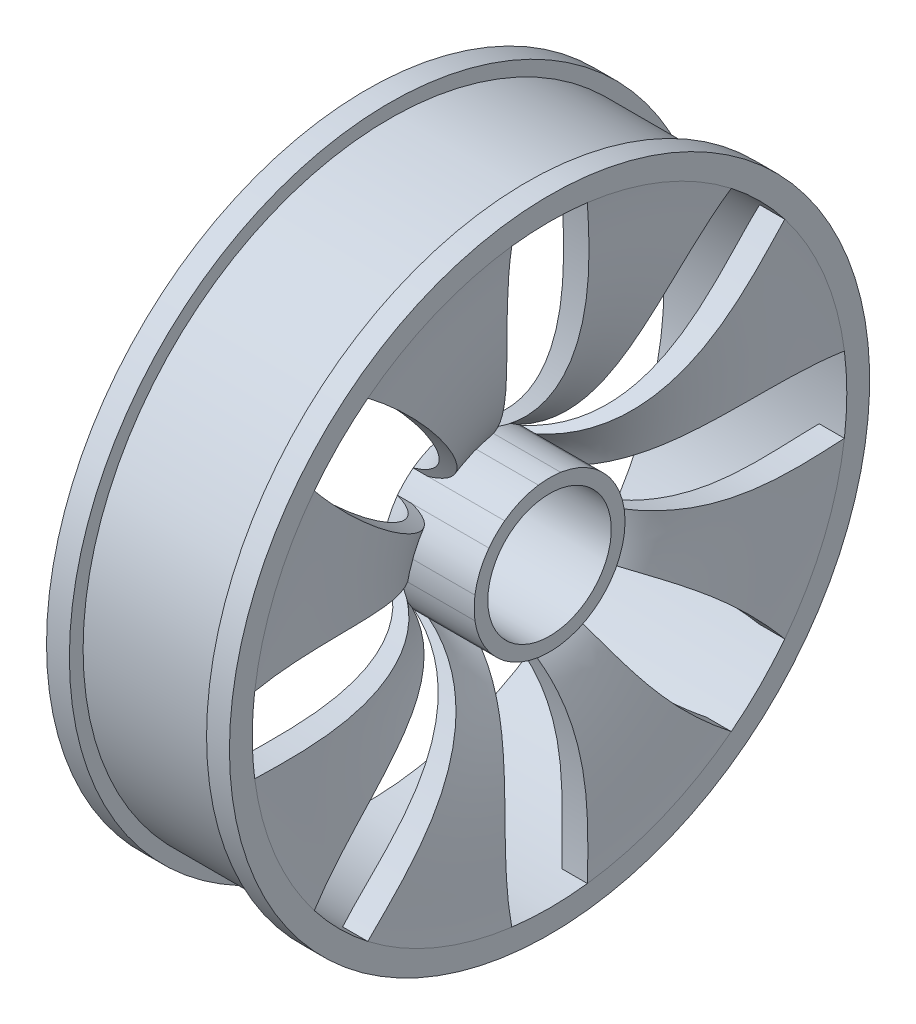
from build123d import *
from build123d.topology import SkipClean

# Parameters (mm, degrees)
CUT_EXTRUDE2_DEPTH = 111.905365064
CIRPATTERN2_COUNT  = 8


with BuildPart() as part:
    # Sketch1 → Revolve1 (revolve)
    with BuildSketch(Plane.XY):
        with BuildLine():
            Line((-20, 65), (13.153734129, 65))
            Line((13.153734129, 65), (14.494744631, 65))
            add(Edge.make_bspline(
                [(14.494744631, 65), (12.502206897, 49.490804575), (18.466776671, 25.24835877), (0, 16.5)],
                knots=[0, 0, 0, 0, 1, 1, 1, 1], degree=3))
            Line((0, 16.5), (0, 13.5))
            Line((0, 13.5), (20, 13.5))
            Line((20, 13.5), (20, 16.5))
            Line((20, 16.5), (3.17570815, 16.5))
            add(Edge.make_bspline(
                [(20, 65), (18.806416268, 48.991043123), (21.654091138, 24.896428401), (3.17570815, 16.5)],
                knots=[0, 0, 0, 0, 1, 1, 1, 1], degree=3))
            Line((20, 65), (20, 70))
            Line((20, 70), (15, 70))
            Line((15, 70), (15, 67))
            Line((15, 67), (-15, 67))
            Line((-15, 67), (-15, 70))
            Line((-15, 70), (-20, 70))
            Line((-20, 70), (-20, 65))
        make_face()
    revolve(axis=Axis((0, 0, 0), (1, 0, 0)))

    # Sketch2 → Cut-Extrude2 (cut, through all)
    with BuildSketch(Plane(origin=(30, 0, 0), x_dir=(0, 0, -1), z_dir=(1, 0, 0))):
        with BuildLine():
            ThreePointArc((-8.269543591, 64.471812824), (0, 65), (8.269543591, 64.471812824))
            add(Edge.make_bspline(
                [(8.269543591, 64.471812824), (11.409595508, 39.756229765), (2.435027422, 16.319333364)],
                knots=[0, 0, 0, 1, 1, 1], degree=2))
            ThreePointArc((2.435027422, 16.319333364), (0, 16.484798286), (-2.435027422, 16.319333364))
            add(Edge.make_bspline(
                [(-8.269543591, 64.471812824), (-10.541737717, 39.835341096), (-2.435027422, 16.319333364)],
                knots=[0, 0, 0, 1, 1, 1], degree=2))
        make_face()
    cut_extrude2 = extrude(amount=-CUT_EXTRUDE2_DEPTH, mode=Mode.SUBTRACT)

    # CirPattern2: Cut-Extrude2 ×8 about axis
    with SkipClean():  # the faces are left unmerged after this step: merging them gives an invalid solid
        cirpattern2_axis = Axis((20, 0, 0), (-1, 0, 0))
        for i in range(1, CIRPATTERN2_COUNT):
            add(cut_extrude2.rotate(cirpattern2_axis, i * 360 / CIRPATTERN2_COUNT), mode=Mode.SUBTRACT)
    add(part.part.scale(1), mode=Mode.REPLACE)  # the faces are merged on a copy


solid = part.part
